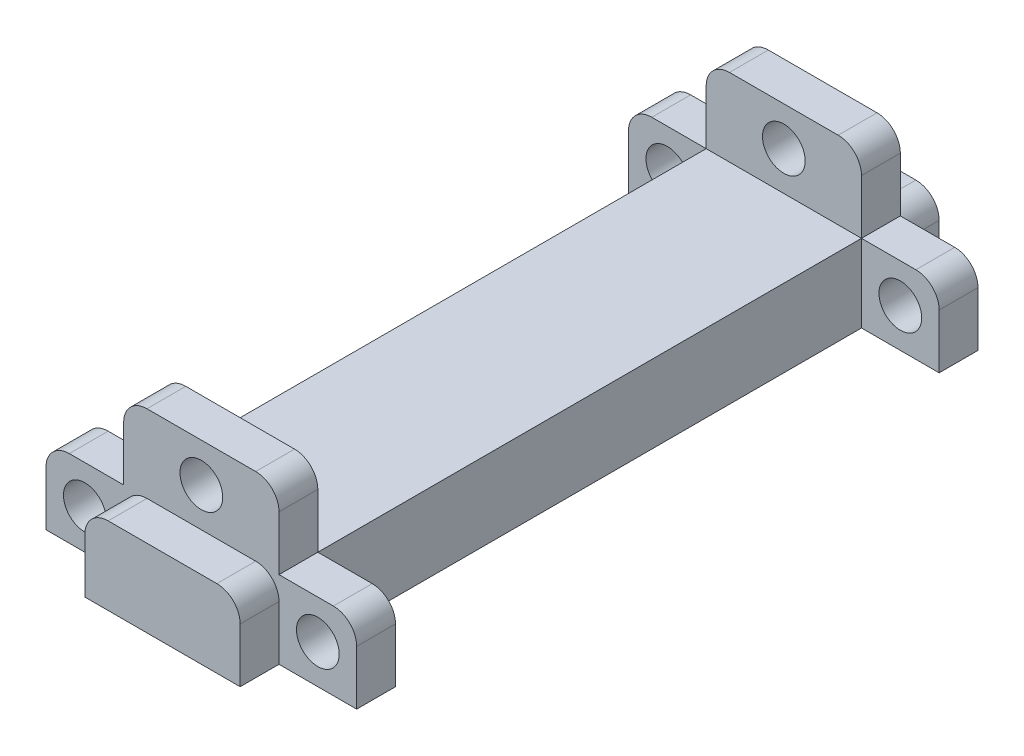
from build123d import *

# Parameters (mm, degrees)
SKETCH_1_W               = 20
SKETCH_1_H               = 10
EXTRUDE_1_DEPTH          = 90
EXTRUDE_START            = -5
SKETCH_2_W               = 10
SKETCH_2_H               = 10
SKETCH_2_W_2             = 20
EXTRUDE_2_DEPTH          = 5
CUT_EXTRUDE_1_DEPTH      = 93.330926563
CUT_EXTRUDE_1_DEPTH_BACK = 93.330926563
SKETCH_3_R               = 2.75
FILLET_1_R               = 3


with BuildPart() as part:
    # 草图1 → 凸台-拉伸1 (new body)
    with BuildSketch(Plane.XY):
        with Locations((10, 5)):
            Rectangle(SKETCH_1_W, SKETCH_1_H)
    extrude(amount=EXTRUDE_1_DEPTH)

    # 草图2 → 凸台-拉伸2 (add)
    with BuildSketch(Plane(origin=(0, 0, 0), x_dir=(-1, 0, 0), z_dir=(0, 0, -1)).offset(EXTRUDE_START)):
        with Locations((-25, 5)):
            Rectangle(SKETCH_2_W, SKETCH_2_H)
        with Locations((-10, 15)):
            Rectangle(SKETCH_2_W_2, SKETCH_2_H)
        with Locations((5, 5)):
            Rectangle(SKETCH_2_W, SKETCH_2_H)
    extrude_2 = extrude(amount=-EXTRUDE_2_DEPTH)

    # 镜向1: 凸台-拉伸2 across plane
    add(extrude_2.mirror(Plane(origin=(0, 0, 45), x_dir=(1, 0, 0), z_dir=(0, 0, -1))))

    # 草图3 → 切除-拉伸1 (cut, two sides: drawn at the far end of the back side and taken through both)
    with BuildSketch(Plane(origin=(0, 0, 5), x_dir=(-1, 0, 0), z_dir=(0, 0, -1)).offset(-CUT_EXTRUDE_1_DEPTH_BACK)):
        with Locations(Location((5, 5, 0), (0, 0, 180))):
            Circle(SKETCH_3_R)
        with Locations(Location((-10, 15, 0), (0, 0, 180))):
            Circle(SKETCH_3_R)
        with Locations(Location((-25, 5, 0), (0, 0, 180))):
            Circle(SKETCH_3_R)
    extrude(amount=CUT_EXTRUDE_1_DEPTH + CUT_EXTRUDE_1_DEPTH_BACK, mode=Mode.SUBTRACT)

    # 圆角1
    # the kernel refuses this fillet: 3 mm, written as the material it takes off along each edge
    with BuildSketch(Plane(origin=(0, 10, -7.5), x_dir=(0, -1, 0), z_dir=(0, 0, 1)), Plane(origin=(0, 10, 85), x_dir=(0, -1, 0), z_dir=(0, 0, 1))) as fillet_1_piece_1:
        with BuildLine():
            CenterArc((FILLET_1_R, FILLET_1_R), FILLET_1_R, 180, 90)
            Line((0, FILLET_1_R), (0, 0))
            Line((0, 0), (FILLET_1_R, 0))
        make_face()
    extrude(amount=12.5, mode=Mode.SUBTRACT)
    with BuildSketch(Plane(origin=(20, 10, -7.5), x_dir=(0, -1, 0), z_dir=(0, 0, 1)), Plane(origin=(20, 10, 85), x_dir=(0, -1, 0), z_dir=(0, 0, 1))) as fillet_1_piece_2:
        with BuildLine():
            CenterArc((FILLET_1_R, -FILLET_1_R), FILLET_1_R, 90, 90)
            Line((0, -FILLET_1_R), (0, 0))
            Line((0, 0), (FILLET_1_R, 0))
        make_face()
    extrude(amount=12.5, mode=Mode.SUBTRACT)
    with BuildSketch(Plane(origin=(20, 20, -2.5), x_dir=(0, -1, 0), z_dir=(0, 0, 1)), Plane(origin=(30, 10, -2.5), x_dir=(0, -1, 0), z_dir=(0, 0, 1)), Plane(origin=(0, 20, 92.5), x_dir=(0, -1, 0), z_dir=(0, 0, -1)), Plane(origin=(-10, 10, 92.5), x_dir=(0, -1, 0), z_dir=(0, 0, -1))) as fillet_1_piece_3:
        with BuildLine():
            CenterArc((FILLET_1_R, -FILLET_1_R), FILLET_1_R, 90, 90)
            Line((0, -FILLET_1_R), (0, 0))
            Line((0, 0), (FILLET_1_R, 0))
        make_face()
    extrude(amount=20, mode=Mode.SUBTRACT)
    with BuildSketch(Plane(origin=(0, 20, -2.5), x_dir=(0, -1, 0), z_dir=(0, 0, 1)), Plane(origin=(-10, 10, -2.5), x_dir=(0, -1, 0), z_dir=(0, 0, 1)), Plane(origin=(30, 10, 92.5), x_dir=(0, -1, 0), z_dir=(0, 0, -1)), Plane(origin=(20, 20, 92.5), x_dir=(0, -1, 0), z_dir=(0, 0, -1))) as fillet_1_piece_4:
        with BuildLine():
            CenterArc((FILLET_1_R, FILLET_1_R), FILLET_1_R, 180, 90)
            Line((0, FILLET_1_R), (0, 0))
            Line((0, 0), (FILLET_1_R, 0))
        make_face()
    extrude(amount=20, mode=Mode.SUBTRACT)


solid = part.part
